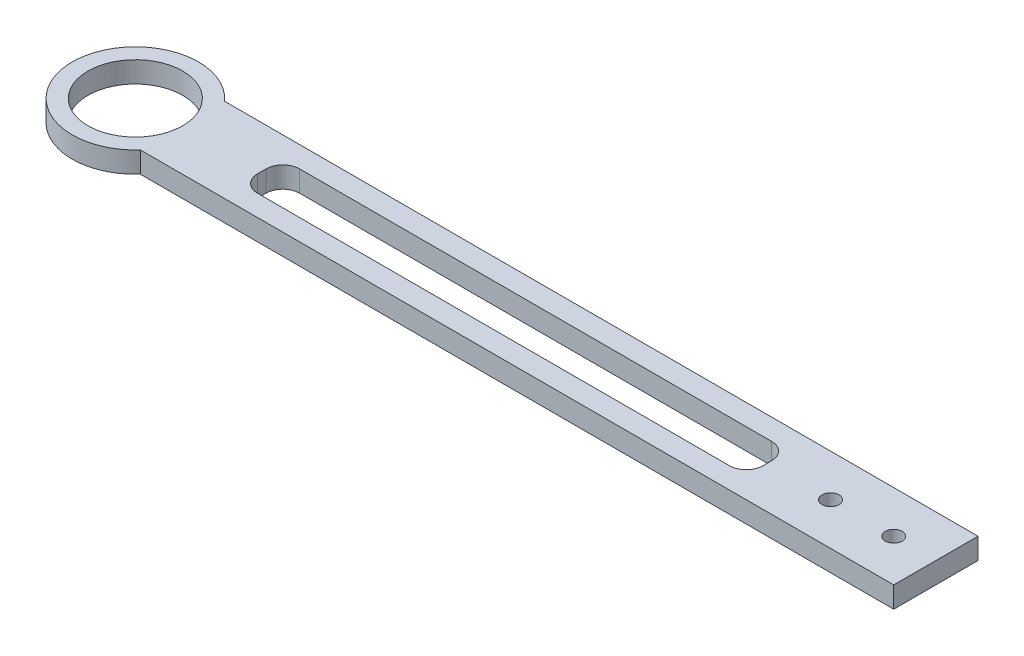
from build123d import *

# Parameters (mm, degrees)
SKETCH1_W              = 254
SKETCH1_H              = 25.4
BOSS_EXTRUDE1_DEPTH    = 3.175
FILLET1_R              = 12.7
F_10_CLEARANCE_HOLE1_D = 5.1054
SKETCH9_W              = 152.4
SKETCH9_H              = 12.7
CUT_EXTRUDE2_DEPTH     = 128.791284914
FILLET2_R              = 5.08
SKETCH11_R             = 19.05
BOSS_EXTRUDE2_DEPTH    = 6.35
SKETCH10_R             = 14.2875
CUT_EXTRUDE3_DEPTH     = 135.853429693


with BuildPart() as part:
    # Sketch1 → Boss-Extrude1 (new, symmetric)
    with BuildSketch(Plane(origin=(0, 0, 0), x_dir=(1, 0, 0), z_dir=(0, 1, 0))):
        Rectangle(SKETCH1_W, SKETCH1_H)
    extrude(amount=BOSS_EXTRUDE1_DEPTH, both=True)

    # Fillet1
    fillet1_edges = [part.edges().sort_by_distance(p)[0] for p in [
        (-127, 0, -12.7),
        (-127, 0, 12.7),
    ]]
    fillet(fillet1_edges, radius=FILLET1_R - 0.0001)  # a hair under: the kernel refuses the full size

    # #10 Clearance Hole1 (through all)
    with Locations(Plane(origin=(0, 3.175, 0), x_dir=(1, 0, 0), z_dir=(0, 1, 0))):
        with Locations((114.3, 0), (95.25, 0)):
            Hole(F_10_CLEARANCE_HOLE1_D / 2)

    # Sketch9 → Cut-Extrude2 (cut, through all)
    with BuildSketch(Plane(origin=(0, 3.175, 0), x_dir=(1, 0, 0), z_dir=(0, 1, 0))):
        Rectangle(SKETCH9_W, SKETCH9_H)
    extrude(amount=-CUT_EXTRUDE2_DEPTH, mode=Mode.SUBTRACT)

    # Fillet2
    fillet2_edges = [part.edges().sort_by_distance(p)[0] for p in [
        (76.2, 0, -6.35),
        (76.2, 0, 6.35),
        (-76.2, 0, 6.35),
        (-76.2, 0, -6.35),
    ]]
    fillet(fillet2_edges, radius=FILLET2_R)

    # Sketch11 → Boss-Extrude2 (add)
    with BuildSketch(Plane.XZ.offset(3.175)):
        with Locations((-114.3, 0)):
            Circle(SKETCH11_R)
    extrude(amount=-BOSS_EXTRUDE2_DEPTH)

    # Sketch10 → Cut-Extrude3 (cut, through all)
    with BuildSketch(Plane.XZ.offset(3.175)):
        with Locations(Location((-114.3, 0, 0), (0, 0, 270))):
            Circle(SKETCH10_R)
    extrude(amount=-CUT_EXTRUDE3_DEPTH, mode=Mode.SUBTRACT)


solid = part.part
